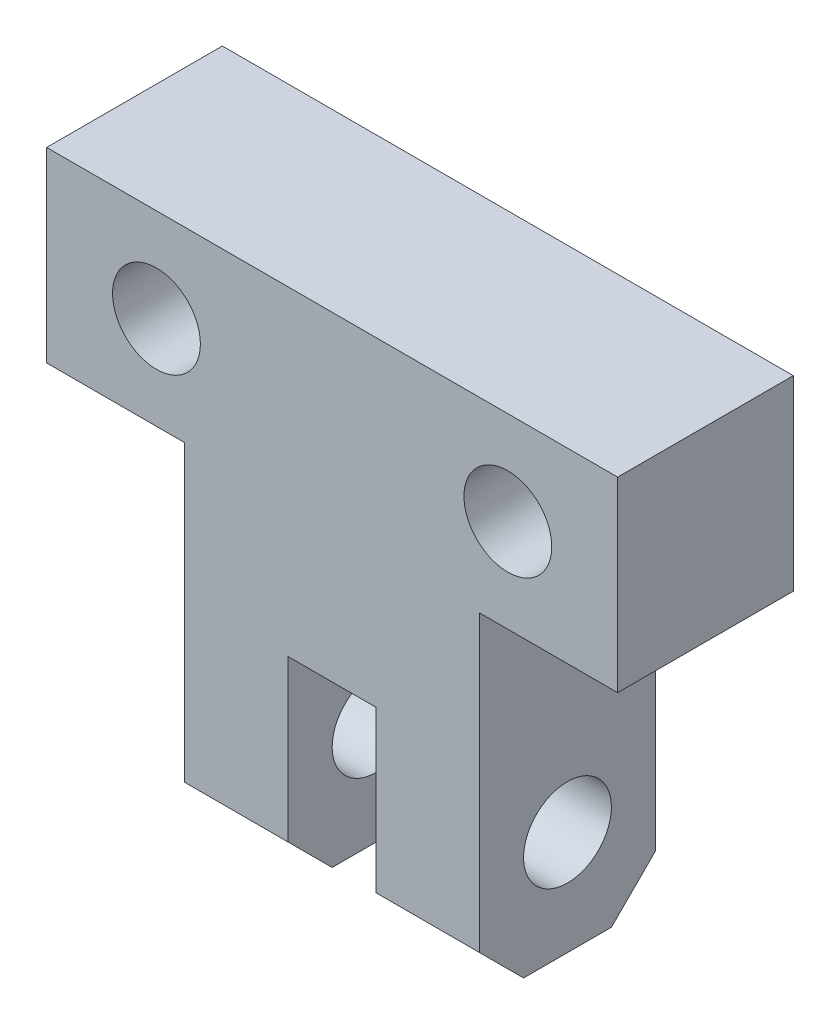
from build123d import *

# Parameters (mm, degrees)
EXTRUDE_1_DEPTH     = 8
SKETCH_2_R          = 2
CUT_EXTRUDE_2_DEPTH = 22.400934559
SKETCH_3_R          = 2
CUT_EXTRUDE_1_DEPTH = 27.033270693
CHAMFER_1_SIZE      = 2


with BuildPart() as part:
    # Эскиз1 → Вытянуть1 (new body)
    with BuildSketch(Plane.XY):
        Polygon((-13, 15), (13, 15), (13, 6.500000002), (6.716266963, 6.500000002), (6.716266963, -8.894499905), (2, -8.894499905), (2, 0.42128884), (-2, 0.42128884), (-2, -8.894499905), (-6.716266963, -8.894499905), (-6.716266963, 6.500000002), (-13, 6.500000002), align=None)
    extrude(amount=EXTRUDE_1_DEPTH)

    # Эскиз2 → Вытянуть2 (cut, through all)
    with BuildSketch(Plane.XY.offset(8)):
        with Locations((-8, 10.748498226)):
            Circle(SKETCH_2_R)
        with Locations((8, 10.750000001)):
            Circle(SKETCH_2_R)
    extrude(amount=-CUT_EXTRUDE_2_DEPTH, mode=Mode.SUBTRACT)

    # Эскиз3 → Вырез-Вытянуть1 (cut, through all)
    with BuildSketch(Plane(origin=(6.716266963, 0, 0), x_dir=(0, 0, -1), z_dir=(1, 0, 0))):
        with Locations((-4, -4.14834478)):
            Circle(SKETCH_3_R)
    extrude(amount=-CUT_EXTRUDE_1_DEPTH, mode=Mode.SUBTRACT)

    # Фаска1
    chamfer_1_edges = [part.edges().sort_by_distance(p)[0] for p in [
        (-4.358133481, -8.894499905, 8),
        (4.358133481, -8.894499905, 8),
        (-4.358133481, -8.894499905, 0),
        (4.358133481, -8.894499905, 0),
    ]]
    chamfer(chamfer_1_edges, length=CHAMFER_1_SIZE)


solid = part.part
